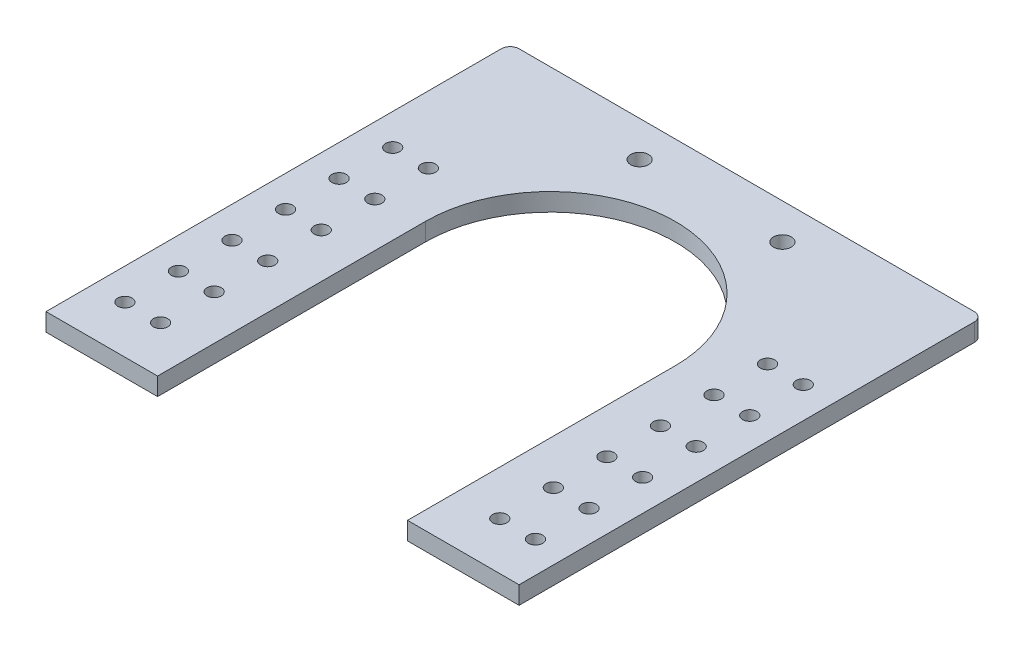
from build123d import *

# Parameters (mm, degrees)
SKETCH1_W                        = 168.275
SKETCH1_H                        = 165.1
BOSS_EXTRUDE1_DEPTH              = 3.175
CUT_EXTRUDE1_REACH               = 120.042
F_1_4_0_25_DIAMETER_HOLE1_D      = 6.35
F_1_4_0_25_DIAMETER_HOLE1_DEPTH  = 25.4
F_1_4_0_25_DIAMETER_HOLE1_TIP    = 1.907732465
F_1_4_20_TAPPED_HOLE1_AT_2_COUNT = 2
F_1_4_20_TAPPED_HOLE1_AT_2_PITCH = 12.7
LPATTERN1_COUNT                  = 6
LPATTERN1_PITCH                  = 19.05
FILLET2_R                        = 3.175


with BuildPart() as part:
    # Sketch1 → Boss-Extrude1 (new, symmetric)
    with BuildSketch(Plane(origin=(0, 0, 0), x_dir=(1, 0, 0), z_dir=(0, 1, 0))):
        Rectangle(SKETCH1_W, SKETCH1_H)
    extrude(amount=BOSS_EXTRUDE1_DEPTH, both=True)

    # Sketch2 → Cut-Extrude1 (cut, up to next)
    with BuildSketch(Plane(origin=(0, 3.175, 0), x_dir=(1, 0, 0), z_dir=(0, 1, 0)), mode=Mode.PRIVATE) as cut_extrude1_sk1:
        with BuildLine():
            ThreePointArc((44.45, 12.7), (0, 57.15), (-44.45, 12.7))
            Line((-44.45, 12.7), (-44.45, -82.55))
            Line((-44.45, -82.55), (44.45, -82.55))
            Line((44.45, -82.55), (44.45, 12.7))
        make_face()
    cut_extrude1_tool1 = extrude(cut_extrude1_sk1.sketch, amount=-CUT_EXTRUDE1_REACH, mode=Mode.PRIVATE) & part.part
    add(cut_extrude1_tool1.solids().sort_by_distance((0, 3.175, 17.091427))[0], mode=Mode.SUBTRACT)

    # 1/4 (0.25) Diameter Hole1
    with Locations(Plane(origin=(0, 3.175, 0), x_dir=(1, 0, 0), z_dir=(0, 1, 0))):
        with Locations((-25.4, 69.85), (25.4, 69.85)):
            Hole(F_1_4_0_25_DIAMETER_HOLE1_D / 2, depth=F_1_4_0_25_DIAMETER_HOLE1_DEPTH)
            with Locations((0, 0, -(F_1_4_0_25_DIAMETER_HOLE1_DEPTH + F_1_4_0_25_DIAMETER_HOLE1_TIP / 2))):  # 118° drill point
                Cone(0, F_1_4_0_25_DIAMETER_HOLE1_D / 2, F_1_4_0_25_DIAMETER_HOLE1_TIP, mode=Mode.SUBTRACT)

    # Sketch10 → 1/4-20 Tapped Hole1 (revolve, cut)
    with BuildSketch(Plane(origin=(-73.025, 3.175, 65.603705108), x_dir=(0, 0, 1), z_dir=(1, 0, 0))):
        Polygon((0, 0), (0, 26.933816902), (2.5527, 25.4), (2.5527, 0), align=None)
    f_1_4_20_tapped_hole1 = revolve(axis=Axis((-73.025, 9.525, 65.603705108), (0, -1, 0)), mode=Mode.SUBTRACT)

    # 1/4-20 Tapped Hole1 at 2: 1/4-20 Tapped Hole1 ×2
    with Locations(*[(i * F_1_4_20_TAPPED_HOLE1_AT_2_PITCH, 0, 0) for i in range(1, F_1_4_20_TAPPED_HOLE1_AT_2_COUNT)]):
        add(f_1_4_20_tapped_hole1, mode=Mode.SUBTRACT)

    # LPattern1: 1/4-20 Tapped Hole1 ×6
    with Locations(*[(0, 0, -i * LPATTERN1_PITCH) for i in range(1, LPATTERN1_COUNT)]):
        add(f_1_4_20_tapped_hole1, mode=Mode.SUBTRACT)

    # LPattern1 copy 1 sketch → LPattern1 copy 1 (revolve, cut)
    with BuildSketch(Plane(origin=(-60.325, 3.175, 46.553705108), x_dir=(0, 0, 1), z_dir=(1, 0, 0))):
        Polygon((0, 0), (0, 26.933816902), (2.5527, 25.4), (2.5527, 0), align=None)
    revolve(axis=Axis((-60.325, 9.525, 46.553705108), (0, -1, 0)), mode=Mode.SUBTRACT)

    # LPattern1 copy 2 sketch → LPattern1 copy 2 (revolve, cut)
    with BuildSketch(Plane(origin=(-60.325, 3.175, 27.503705108), x_dir=(0, 0, 1), z_dir=(1, 0, 0))):
        Polygon((0, 0), (0, 26.933816902), (2.5527, 25.4), (2.5527, 0), align=None)
    revolve(axis=Axis((-60.325, 9.525, 27.503705108), (0, -1, 0)), mode=Mode.SUBTRACT)

    # LPattern1 copy 3 sketch → LPattern1 copy 3 (revolve, cut)
    with BuildSketch(Plane(origin=(-60.325, 3.175, 8.453705108), x_dir=(0, 0, 1), z_dir=(1, 0, 0))):
        Polygon((0, 0), (0, 26.933816902), (2.5527, 25.4), (2.5527, 0), align=None)
    revolve(axis=Axis((-60.325, 9.525, 8.453705108), (0, -1, 0)), mode=Mode.SUBTRACT)

    # LPattern1 copy 4 sketch → LPattern1 copy 4 (revolve, cut)
    with BuildSketch(Plane(origin=(-60.325, 3.175, -10.596294892), x_dir=(0, 0, 1), z_dir=(1, 0, 0))):
        Polygon((0, 0), (0, 26.933816902), (2.5527, 25.4), (2.5527, 0), align=None)
    revolve(axis=Axis((-60.325, 9.525, -10.596294892), (0, -1, 0)), mode=Mode.SUBTRACT)

    # LPattern1 copy 5 sketch → LPattern1 copy 5 (revolve, cut)
    with BuildSketch(Plane(origin=(-60.325, 3.175, -29.646294892), x_dir=(0, 0, 1), z_dir=(1, 0, 0))):
        Polygon((0, 0), (0, 26.933816902), (2.5527, 25.4), (2.5527, 0), align=None)
    revolve(axis=Axis((-60.325, 9.525, -29.646294892), (0, -1, 0)), mode=Mode.SUBTRACT)

    # Mirror1 copy 1 sketch → Mirror1 copy 1 (revolve, cut)
    with BuildSketch(Plane(origin=(73.025, 3.175, 46.553705108), x_dir=(0, 0, 1), z_dir=(-1, 0, 0))):
        Polygon((0, 0), (0, -26.933816902), (2.5527, -25.4), (2.5527, 0), align=None)
    revolve(axis=Axis((73.025, 9.525, 46.553705108), (0, 1, 0)), mode=Mode.SUBTRACT)

    # Mirror1 copy 2 sketch → Mirror1 copy 2 (revolve, cut)
    with BuildSketch(Plane(origin=(73.025, 3.175, 27.503705108), x_dir=(0, 0, 1), z_dir=(-1, 0, 0))):
        Polygon((0, 0), (0, -26.933816902), (2.5527, -25.4), (2.5527, 0), align=None)
    revolve(axis=Axis((73.025, 9.525, 27.503705108), (0, 1, 0)), mode=Mode.SUBTRACT)

    # Mirror1 copy 3 sketch → Mirror1 copy 3 (revolve, cut)
    with BuildSketch(Plane(origin=(73.025, 3.175, 8.453705108), x_dir=(0, 0, 1), z_dir=(-1, 0, 0))):
        Polygon((0, 0), (0, -26.933816902), (2.5527, -25.4), (2.5527, 0), align=None)
    revolve(axis=Axis((73.025, 9.525, 8.453705108), (0, 1, 0)), mode=Mode.SUBTRACT)

    # Mirror1 copy 4 sketch → Mirror1 copy 4 (revolve, cut)
    with BuildSketch(Plane(origin=(73.025, 3.175, -10.596294892), x_dir=(0, 0, 1), z_dir=(-1, 0, 0))):
        Polygon((0, 0), (0, -26.933816902), (2.5527, -25.4), (2.5527, 0), align=None)
    revolve(axis=Axis((73.025, 9.525, -10.596294892), (0, 1, 0)), mode=Mode.SUBTRACT)

    # Mirror1 copy 5 sketch → Mirror1 copy 5 (revolve, cut)
    with BuildSketch(Plane(origin=(73.025, 3.175, -29.646294892), x_dir=(0, 0, 1), z_dir=(-1, 0, 0))):
        Polygon((0, 0), (0, -26.933816902), (2.5527, -25.4), (2.5527, 0), align=None)
    revolve(axis=Axis((73.025, 9.525, -29.646294892), (0, 1, 0)), mode=Mode.SUBTRACT)

    # Mirror1 copy 6 sketch → Mirror1 copy 6 (revolve, cut)
    with BuildSketch(Plane(origin=(60.325, 3.175, 46.553705108), x_dir=(0, 0, 1), z_dir=(-1, 0, 0))):
        Polygon((0, 0), (0, -26.933816902), (2.5527, -25.4), (2.5527, 0), align=None)
    revolve(axis=Axis((60.325, 9.525, 46.553705108), (0, 1, 0)), mode=Mode.SUBTRACT)

    # Mirror1 copy 7 sketch → Mirror1 copy 7 (revolve, cut)
    with BuildSketch(Plane(origin=(60.325, 3.175, 27.503705108), x_dir=(0, 0, 1), z_dir=(-1, 0, 0))):
        Polygon((0, 0), (0, -26.933816902), (2.5527, -25.4), (2.5527, 0), align=None)
    revolve(axis=Axis((60.325, 9.525, 27.503705108), (0, 1, 0)), mode=Mode.SUBTRACT)

    # Mirror1 copy 8 sketch → Mirror1 copy 8 (revolve, cut)
    with BuildSketch(Plane(origin=(60.325, 3.175, 8.453705108), x_dir=(0, 0, 1), z_dir=(-1, 0, 0))):
        Polygon((0, 0), (0, -26.933816902), (2.5527, -25.4), (2.5527, 0), align=None)
    revolve(axis=Axis((60.325, 9.525, 8.453705108), (0, 1, 0)), mode=Mode.SUBTRACT)

    # Mirror1 copy 9 sketch → Mirror1 copy 9 (revolve, cut)
    with BuildSketch(Plane(origin=(60.325, 3.175, -10.596294892), x_dir=(0, 0, 1), z_dir=(-1, 0, 0))):
        Polygon((0, 0), (0, -26.933816902), (2.5527, -25.4), (2.5527, 0), align=None)
    revolve(axis=Axis((60.325, 9.525, -10.596294892), (0, 1, 0)), mode=Mode.SUBTRACT)

    # Mirror1 copy 10 sketch → Mirror1 copy 10 (revolve, cut)
    with BuildSketch(Plane(origin=(60.325, 3.175, -29.646294892), x_dir=(0, 0, 1), z_dir=(-1, 0, 0))):
        Polygon((0, 0), (0, -26.933816902), (2.5527, -25.4), (2.5527, 0), align=None)
    revolve(axis=Axis((60.325, 9.525, -29.646294892), (0, 1, 0)), mode=Mode.SUBTRACT)

    # Mirror1 copy 11 sketch → Mirror1 copy 11 (revolve, cut)
    with BuildSketch(Plane(origin=(73.025, 3.175, 65.603705108), x_dir=(0, 0, 1), z_dir=(-1, 0, 0))):
        Polygon((0, 0), (0, -26.933816902), (2.5527, -25.4), (2.5527, 0), align=None)
    revolve(axis=Axis((73.025, 9.525, 65.603705108), (0, 1, 0)), mode=Mode.SUBTRACT)

    # Mirror1 copy 12 sketch → Mirror1 copy 12 (revolve, cut)
    with BuildSketch(Plane(origin=(60.325, 3.175, 65.603705108), x_dir=(0, 0, 1), z_dir=(-1, 0, 0))):
        Polygon((0, 0), (0, -26.933816902), (2.5527, -25.4), (2.5527, 0), align=None)
    revolve(axis=Axis((60.325, 9.525, 65.603705108), (0, 1, 0)), mode=Mode.SUBTRACT)

    # Fillet2
    fillet2_edges = [part.edges().sort_by_distance(p)[0] for p in [
        (84.1375, 0, -82.55),
        (-84.1375, 0, -82.55),
    ]]
    fillet(fillet2_edges, radius=FILLET2_R)


solid = part.part
